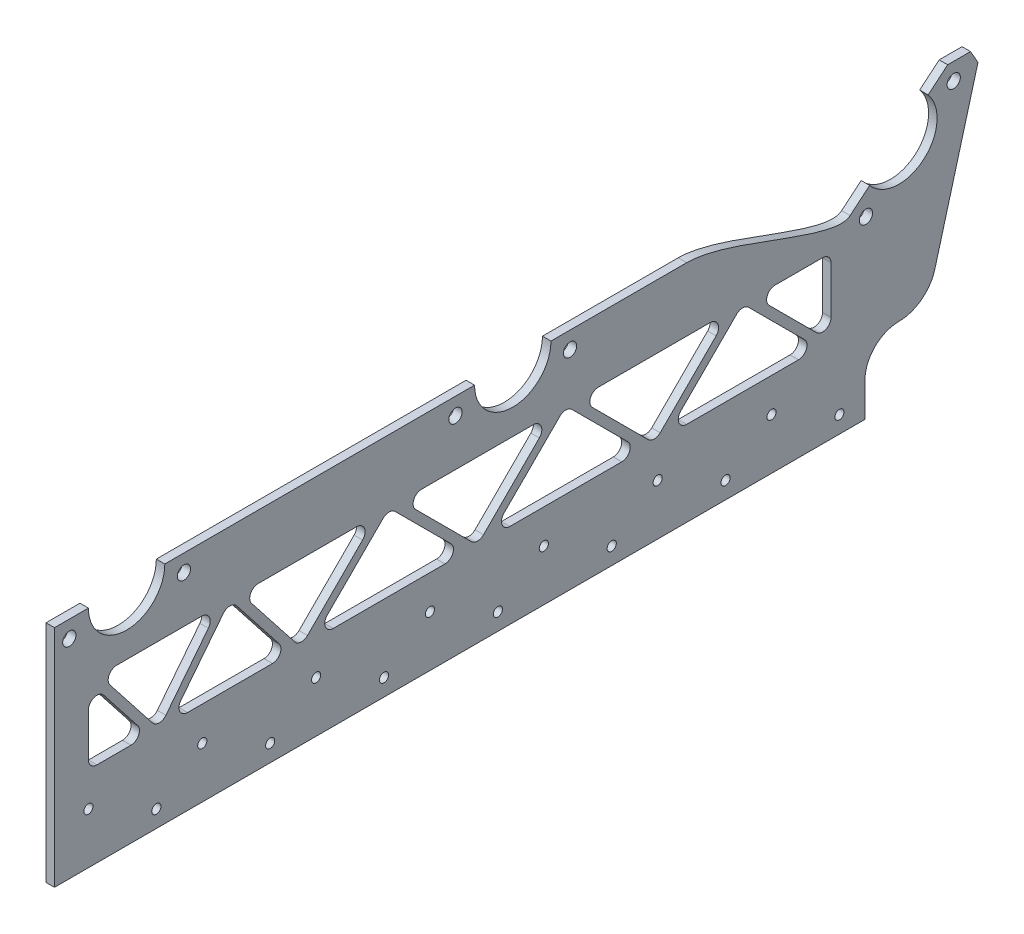
from build123d import *

# Parameters (mm, degrees)
BOSS_EXTRUDE1_DEPTH              = 3.175
F_10_CLEARANCE_HOLE1_D           = 4.9784
CHAMFER1_SIZE                    = 5.08
CHAMFER1_SIZE2                   = 4.134495326
F_1_8_0_135_DIAMETER_HOLE1_D     = 3.429
F_1_8_0_135_DIAMETER_HOLE1_DEPTH = 16.51
F_1_8_0_135_DIAMETER_HOLE1_TIP   = 1.030175531
CUT_EXTRUDE1_DEPTH               = 328.621032852
FILLET1_R                        = 3.175


with BuildPart() as part:
    # Sketch1 → Boss-Extrude1 (new body)
    with BuildSketch(Plane(origin=(0, 0, 0), x_dir=(0, 0, -1), z_dir=(1, 0, 0))):
        with BuildLine():
            Line((-12.7, -12.7), (-315.9125, -12.7))
            Line((-315.9125, -12.7), (-315.9125, 71.4375))
            Line((-315.9125, 71.4375), (-303.2125, 71.4375))
            ThreePointArc((-303.2125, 71.4375), (-288.925, 57.15), (-274.6375, 71.4375))
            Line((-274.6375, 71.4375), (-158.75, 71.4375))
            ThreePointArc((-158.75, 71.4375), (-144.4625, 57.15), (-130.175, 71.4375))
            Line((-130.175, 71.4375), (-79.375, 71.4375))
            add(Edge.make_bspline(
                [(-18.243165022, 56.129666959), (-24.729007974, 50.68739853), (-62.441666667, 71.4375), (-79.375, 71.4375)],
                knots=[0, 0, 0, 0, 1, 1, 1, 1], degree=3))
            Line((-18.243165022, 56.129666959), (-10.944859981, 62.253672027))
            ThreePointArc((-10.944859981, 62.253672027), (9.183827973, 60.492640019), (10.944859981, 80.621327973))
            Line((10.944859981, 80.621327973), (18.243165022, 86.745333041))
            Line((18.243165022, 86.745333041), (30.943165022, 86.745333041))
            Line((30.943165022, 86.745333041), (13.473517024, 22.978761859))
            ThreePointArc((13.473517024, 22.978761859), (8.473319986, 15.563076555), (0, 12.7))
            ThreePointArc((0, 12.7), (-8.980256121, 8.980256121), (-12.7, 0))
            Line((-12.7, 0), (-12.7, -12.7))
        make_face()
    extrude(amount=BOSS_EXTRUDE1_DEPTH)

    # #10 Clearance Hole1 (through all)
    with Locations(Plane(origin=(3.175, 0, 0), x_dir=(0, 0, -1), z_dir=(1, 0, 0))):
        with Locations((-310.35625, 65.0875), (-267.49375, 65.0875), (-165.89375, 65.0875), (-123.03125, 65.0875), (-12.33558865, 52.797375826), (20.498991293, 80.348859746)):
            Hole(F_10_CLEARANCE_HOLE1_D / 2)

    # Chamfer1
    chamfer1_edges = [part.edges().sort_by_distance(p)[0] for p in [
        (1.5875, 86.745333041, -30.943165022),
    ]]
    chamfer1_side = [part.faces().sort_by_distance(p)[0] for p in [
        (1.5875, 54.86204745, -22.208341023),
    ]]
    chamfer(chamfer1_edges, length=CHAMFER1_SIZE, length2=CHAMFER1_SIZE2, reference=chamfer1_side[0])

    # 1/8 (0.135) Diameter Hole1
    with Locations(Plane(origin=(3.175, 0, 0), x_dir=(0, 0, -1), z_dir=(1, 0, 0))):
        with Locations((-22.2504, -6.35), (-47.6504, 6.35), (-64.844083333, -6.35), (-90.244083333, 6.35), (-107.437766667, -6.35), (-132.837766667, 6.35), (-150.03145, -6.35), (-175.43145, 6.35), (-192.625133333, -6.35), (-218.025133333, 6.35), (-235.218816667, -6.35), (-260.618816667, 6.35), (-277.8125, -6.35), (-303.2125, 6.35)):
            Hole(F_1_8_0_135_DIAMETER_HOLE1_D / 2, depth=F_1_8_0_135_DIAMETER_HOLE1_DEPTH)
            with Locations((0, 0, -(F_1_8_0_135_DIAMETER_HOLE1_DEPTH + F_1_8_0_135_DIAMETER_HOLE1_TIP / 2))):  # 118° drill point
                Cone(0, F_1_8_0_135_DIAMETER_HOLE1_D / 2, F_1_8_0_135_DIAMETER_HOLE1_TIP, mode=Mode.SUBTRACT)

    # Sketch6 → Cut-Extrude1 (cut, through all)
    with BuildSketch(Plane(origin=(3.175, 0, 0), x_dir=(0, 0, -1), z_dir=(1, 0, 0))):
        Polygon((-303.2125, 47.625), (-303.2125, 19.05), (-280.775387252, 19.05), align=None)
        Polygon((-299.175702202, 47.625), (-276.738589454, 19.05), (-254.301476707, 47.625), align=None)
        Polygon((-272.701791656, 19.05), (-250.264678909, 47.625), (-227.827566161, 19.05), align=None)
        Polygon((-246.227881111, 47.625), (-223.790768363, 19.05), (-195.215768363, 47.625), align=None)
        Polygon((-219.300640303, 19.05), (-190.725640303, 47.625), (-162.150640303, 19.05), align=None)
        Polygon((-186.235512242, 47.625), (-157.660512242, 19.05), (-129.085512242, 47.625), align=None)
        Polygon((-124.595384182, 47.625), (-153.170384182, 19.05), (-96.020384182, 19.05), align=None)
        Polygon((-120.105256121, 47.625), (-91.530256121, 19.05), (-62.955256121, 47.625), align=None)
        Polygon((-58.465128061, 47.625), (-87.040128061, 19.05), (-29.890128061, 19.05), align=None)
        Polygon((-53.975, 47.625), (-25.4, 19.05), (-25.4, 47.625), align=None)
    extrude(amount=-CUT_EXTRUDE1_DEPTH, mode=Mode.SUBTRACT)

    # Fillet1
    fillet1_edges = [part.edges().sort_by_distance(p)[0] for p in [
        (1.5875, 19.05, 25.4),
        (1.5875, 47.625, 53.975),
        (1.5875, 47.625, 25.4),
        (1.5875, 19.05, 162.150640303),
        (1.5875, 19.05, 219.300640303),
        (1.5875, 19.05, 91.530256121),
        (1.5875, 47.625, 120.105256121),
        (1.5875, 47.625, 62.955256121),
        (1.5875, 19.05, 87.040128061),
        (1.5875, 47.625, 58.465128061),
        (1.5875, 19.05, 29.890128061),
        (1.5875, 19.05, 157.660512242),
        (1.5875, 47.625, 186.235512242),
        (1.5875, 47.625, 129.085512242),
        (1.5875, 19.05, 153.170384182),
        (1.5875, 47.625, 124.595384182),
        (1.5875, 19.05, 96.020384182),
        (1.5875, 47.625, 190.725640303),
        (1.5875, 19.05, 223.790768363),
        (1.5875, 47.625, 246.227881111),
        (1.5875, 47.625, 195.215768363),
        (1.5875, 19.05, 227.827566161),
        (1.5875, 19.05, 272.701791656),
        (1.5875, 47.625, 250.264678909),
        (1.5875, 19.05, 276.738589454),
        (1.5875, 47.625, 299.175702202),
        (1.5875, 47.625, 254.301476707),
        (1.5875, 19.05, 303.2125),
        (1.5875, 19.05, 280.775387252),
        (1.5875, 47.625, 303.2125),
    ]]
    fillet(fillet1_edges, radius=FILLET1_R)


solid = part.part
